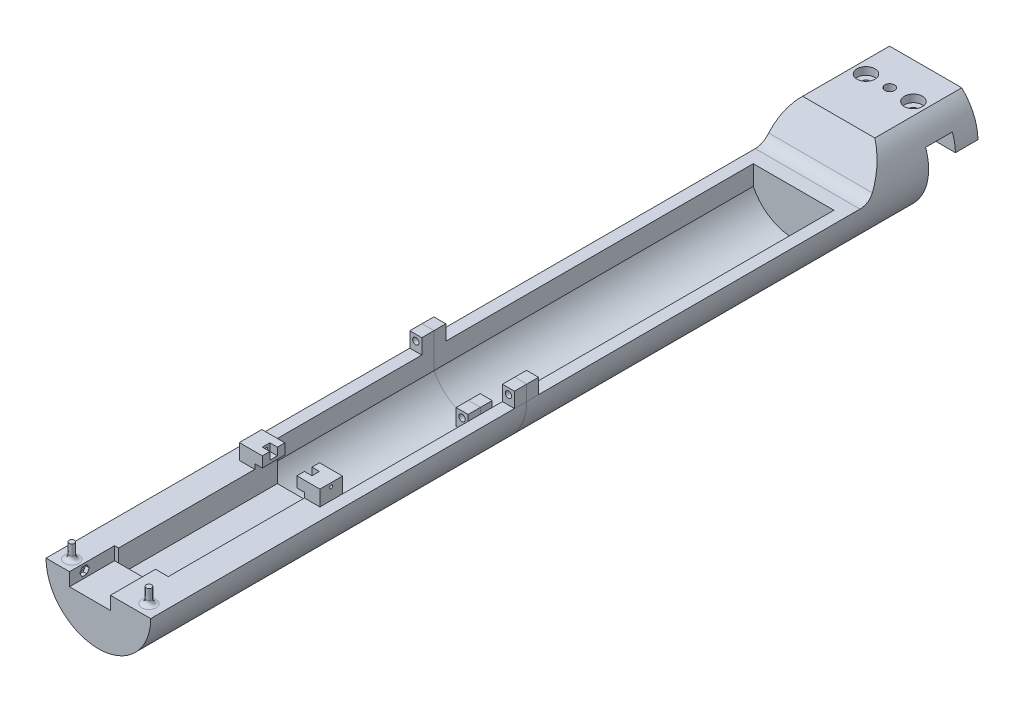
from build123d import *

# Parameters (mm, degrees)
F_1000MM_DEPTH           = 550
F_45MM_46MM_DEPTH        = 17.8
CUT_EXTRUDE_2_REACH      = 554.607
SKETCH_4_R               = 3.25
SKETCH_4_R_2             = 2.3
F_6_5MM_5MM_DEPTH        = 17.8
SKETCH_10_R              = 2.3
DEEP16MM_DEPTH           = 16
SKETCH_16_R              = 6
F_5MM_DEPTH              = 5
SKETCH_17_R              = 6
F_5MM_2_DEPTH            = 5
CUT_EXTRUDE_START        = -477.2
CUT_EXTRUDE_7_DEPTH      = 477.2
F_69_6MM_DEPTH           = 50
FILLET_1_R               = 10
SKETCH_22_W              = 33
SKETCH_22_H              = 15.7
CUT_EXTRUDE_9_DEPTH      = 200
CUT_EXTRUDE_START_2      = 87.8
CUT_EXTRUDE_12_DEPTH     = 326.7
SKETCH5_W                = 10.3
SKETCH5_H                = 10.3
BOSS_EXTRUDE1_DEPTH      = 0.1
SKETCH11_W               = 2.7
SKETCH11_H               = 30
CUT_EXTRUDE5_DEPTH       = 15.7
SKETCH12_W               = 8.5
SKETCH12_H               = 30
BOSS_EXTRUDE2_DEPTH      = 15.7
SKETCH14_W               = 27.2
SKETCH14_H               = 30
BOSS_EXTRUDE3_DEPTH      = 7
SKETCH19_W               = 8
SKETCH19_H               = 16
BOSS_EXTRUDE5_DEPTH      = 10
CUT_EXTRUDE9_REACH       = 314.797
SKETCH20_R               = 2.1
BOSS_EXTRUDE7_REACH      = 554.854
BOSS_EXTRUDE7_END_RADIUS = 29.8
SKETCH22_W               = 8
SKETCH22_H               = 16
CUT_EXTRUDE10_REACH      = 314.797
SKETCH23_R               = 2.1
SKETCH_32_R              = 1.8
BOSS_EXTRUDE9_DEPTH      = 10
FILLET4_R                = 3
CUT_EXTRUDE11_REACH      = 556.148
CUT_EXTRUDE11_END_RADIUS = 34.8
SKETCH13_R               = 1.6
CUT_EXTRUDE12_DEPTH      = 2.5
SKETCH25_R               = 3
CUT_EXTRUDE13_DEPTH      = 10
SKETCH26_W               = 5
SKETCH26_H               = 7
BOSS_EXTRUDE10_DEPTH     = 15
SKETCH27_W               = 5
SKETCH27_H               = 5
CUT_EXTRUDE14_DEPTH      = 5
SKETCH28_R               = 1
CUT_EXTRUDE15_DEPTH      = 555.93966755


# Read off the part's stored shape, not the designer's step: 切除-拉伸12
with BuildPart() as part:
    # 草图1 → 1000mm (new body)
    with BuildSketch(Plane.XY):
        with BuildLine():
            Line((24, 19.214285714), (-24, 19.214285714))
            ThreePointArc((-24, 19.214285714), (0, -40.785714286), (24, 19.214285714))
        make_face()
    extrude(amount=F_1000MM_DEPTH)

    # 草图2 → 45mm到46mm (cut)
    with BuildSketch(Plane(origin=(0, 0, 15), x_dir=(-1, 0, 0), z_dir=(0, 0, -1))):
        with BuildLine():
            Line((-32.77422768, 5.714285714), (32.77422768, 5.714285714))
            ThreePointArc((32.77422768, 5.714285714), (0, -40.785714286), (-32.77422768, 5.714285714))
        make_face()
    extrude(amount=-F_45MM_46MM_DEPTH, mode=Mode.SUBTRACT)

    # 草图3 → 切除-拉伸2 (cut, up to next)
    with BuildSketch(Plane(origin=(0, 0, 0), x_dir=(-1, 0, 0), z_dir=(0, 0, -1)), mode=Mode.PRIVATE) as cut_extrude_2_sk1:
        with BuildLine():
            Line((-34.792959058, -5.285714286), (34.792959058, -5.285714286))
            ThreePointArc((34.792959058, -5.285714286), (0, -40.785714286), (-34.792959058, -5.285714286))
        make_face()
    cut_extrude_2_tool1 = extrude(cut_extrude_2_sk1.sketch, amount=-CUT_EXTRUDE_2_REACH, mode=Mode.PRIVATE) & part.part
    add(cut_extrude_2_tool1.solids().sort_by_distance((0, -20.377758, 0))[0], mode=Mode.SUBTRACT)

    # 草图4 → 6.5mm&5mm (cut)
    with BuildSketch(Plane.XZ.offset(-5.714285714)):
        with Locations(Location((0, 23.9, 0), (0, 0, 270))):
            Circle(SKETCH_4_R)
        with Locations(Location((-15.77422768, 23.9, 0), (0, 0, 270))):
            Circle(SKETCH_4_R_2)
        with Locations(Location((15.77422768, 23.9, 0), (0, 0, 270))):
            Circle(SKETCH_4_R_2)
    extrude(amount=-F_6_5MM_5MM_DEPTH, mode=Mode.SUBTRACT)

    # 草图10 → 圆孔deep16mm (cut)
    with BuildSketch(Plane.XY.offset(32.8)):
        with Locations((-16, -15.785714286)):
            Circle(SKETCH_10_R)
        with Locations(Location((16, -15.785714286, 0), (0, 0, 180))):
            Circle(SKETCH_10_R)
    extrude(amount=DEEP16MM_DEPTH, mode=Mode.SUBTRACT)

    # 草图16 → 5mm (cut)
    with BuildSketch(Plane(origin=(0, 19.214285714, 0), x_dir=(1, 0, 0), z_dir=(0, 1, 0))):
        with Locations(Location((-15.77422768, -23.9, 0), (0, 0, 270))):
            Circle(SKETCH_16_R)
        with Locations(Location((15.77422768, -23.9, 0), (0, 0, 270))):
            Circle(SKETCH_16_R)
    extrude(amount=-F_5MM_DEPTH, mode=Mode.SUBTRACT)

    # 草图17 → 5mm 2 (cut)
    with BuildSketch(Plane(origin=(0, 0, 32.8), x_dir=(-1, 0, 0), z_dir=(0, 0, -1))):
        with Locations((-16, -15.785714286)):
            Circle(SKETCH_17_R)
        with Locations((16, -15.785714286)):
            Circle(SKETCH_17_R)
    extrude(amount=-F_5MM_2_DEPTH, mode=Mode.SUBTRACT)

    # 草图19 → 切除-拉伸7 (cut)
    with BuildSketch(Plane.XY.offset(550).offset(CUT_EXTRUDE_START)):
        with BuildLine():
            Line((-34.8, -5.985714286), (34.8, -5.985714286))
            ThreePointArc((34.8, -5.985714286), (0, 28.814285714), (-34.8, -5.985714286))
        make_face()
    extrude(amount=CUT_EXTRUDE_7_DEPTH, mode=Mode.SUBTRACT)

    # 草图20 → 宽69.6mm (cut, symmetric)
    with BuildSketch(Plane(origin=(0, 0, 0), x_dir=(0, 0, -1), z_dir=(1, 0, 0))):
        Polygon((-72.8, -5.985714286), (-57.8, 19.214285714), (-72.8, 19.214285714), align=None)
    extrude(amount=F_69_6MM_DEPTH, both=True, mode=Mode.SUBTRACT)

    # 圆角1
    fillet_1_edges = [part.edges().sort_by_distance(p)[0] for p in [
        (0, -5.985714286, 72.8),
    ]]
    fillet(fillet_1_edges, radius=FILLET_1_R)

    # 草图22 → 切除-拉伸9 (cut)
    with BuildSketch(Plane.XY.offset(550)):
        with Locations((0, -13.835714286)):
            Rectangle(SKETCH_22_W, SKETCH_22_H)
    extrude(amount=-CUT_EXTRUDE_9_DEPTH, mode=Mode.SUBTRACT)

    # 切除-拉伸12 outline → 切除-拉伸12 (cut)
    with BuildSketch(Plane.XY.offset(CUT_EXTRUDE_START_2)):
        with BuildLine():
            Line((-26.8, -5.985714286), (-26.8, -19.016447189))
            ThreePointArc((-26.8, -19.016447189), (0, -35.785714286), (26.8, -19.016447189))
            Line((26.8, -19.016447189), (26.8, -5.985714286))
            Line((26.8, -5.985714286), (-26.8, -5.985714286))
        make_face()
    extrude(amount=CUT_EXTRUDE_12_DEPTH, mode=Mode.SUBTRACT)

    # Sketch5 → Boss-Extrude1 (add)
    with BuildSketch(Plane(origin=(0, 0, 414.5), x_dir=(-1, 0, 0), z_dir=(0, 0, -1))):
        with Locations((21.65, -0.835714286)):
            Rectangle(SKETCH5_W, SKETCH5_H)
    extrude(amount=-BOSS_EXTRUDE1_DEPTH)


with BuildPart() as body_2:
    # Split1: the piece on the far side of the plane
    add(part.part)
    split(bisect_by=Plane(origin=(0, 0, 300), x_dir=(-1, 0, 0), z_dir=(0, 0, -1)), keep=Keep.BOTTOM)

    # Sketch11 → Cut-Extrude5 (cut)
    with BuildSketch(Plane(origin=(0, -5.985714286, 0), x_dir=(1, 0, 0), z_dir=(0, 1, 0))):
        with Locations((-17.85, -535)):
            Rectangle(SKETCH11_W, SKETCH11_H)
    extrude(amount=-CUT_EXTRUDE5_DEPTH, mode=Mode.SUBTRACT)

    # Sketch12 → Boss-Extrude2 (add)
    with BuildSketch(Plane(origin=(0, -5.985714286, 0), x_dir=(1, 0, 0), z_dir=(0, 1, 0))):
        with Locations((12.25, -535)):
            Rectangle(SKETCH12_W, SKETCH12_H)
    extrude(amount=-BOSS_EXTRUDE2_DEPTH)

    # Sketch14 → Boss-Extrude3 (add)
    with BuildSketch(Plane(origin=(0, -21.685714286, 0), x_dir=(1, 0, 0), z_dir=(0, 1, 0))):
        with Locations((-5.6, -535)):
            Rectangle(SKETCH14_W, SKETCH14_H)
    extrude(amount=BOSS_EXTRUDE3_DEPTH)


with BuildPart() as part_1:
    add(part.part)

    # Split1
    split(bisect_by=Plane(origin=(0, 0, 300), x_dir=(-1, 0, 0), z_dir=(0, 0, -1)), keep=Keep.TOP)

    add(body_2.part)  # Boss-Extrude5 merges body 2
    # Sketch19 → Boss-Extrude5 (add)
    with BuildSketch(Plane(origin=(0, -5.985714286, 0), x_dir=(1, 0, 0), z_dir=(0, 1, 0))):
        with Locations((-30.8, -300.168081581)):
            Rectangle(SKETCH19_W, SKETCH19_H)
        with Locations((30.8, -300.168081581)):
            Rectangle(SKETCH19_W, SKETCH19_H)
    extrude(amount=BOSS_EXTRUDE5_DEPTH)

    # Sketch20 → Cut-Extrude9 (cut, up to next)
    with BuildSketch(Plane.XY.offset(308.168081581), mode=Mode.PRIVATE) as cut_extrude9_sk1:
        with Locations((-30.8, 0.014285714)):
            Circle(SKETCH20_R)
    cut_extrude9_tool1 = extrude(cut_extrude9_sk1.sketch, amount=-CUT_EXTRUDE9_REACH, mode=Mode.PRIVATE) & part_1.part
    # Sketch20 → Cut-Extrude9 (cut, up to next)
    with BuildSketch(Plane.XY.offset(308.168081581), mode=Mode.PRIVATE) as cut_extrude9_sk2:
        with Locations((30.8, 0.014285714)):
            Circle(SKETCH20_R)
    cut_extrude9_tool2 = extrude(cut_extrude9_sk2.sketch, amount=-CUT_EXTRUDE9_REACH, mode=Mode.PRIVATE) & part_1.part
    add(cut_extrude9_tool1.solids().sort_by_distance((-30.8, 0.014286, 308.168082))[0], mode=Mode.SUBTRACT)
    add(cut_extrude9_tool2.solids().sort_by_distance((30.8, 0.014286, 308.168082))[0], mode=Mode.SUBTRACT)

    # Boss-Extrude7: up to this cylinder (the profile starts inside it)
    boss_extrude7_end = Plane(origin=(0, -5.985714286, 300.168082), z_dir=(0, 0, -1)) * Cylinder(BOSS_EXTRUDE7_END_RADIUS, 1170.308, mode=Mode.PRIVATE)
    # Sketch22 → Boss-Extrude7 (add, up to the surface)
    with BuildSketch(Plane(origin=(0, -24.785714286, 0), x_dir=(-1, 0, 0), z_dir=(0, -1, 0)), mode=Mode.PRIVATE) as boss_extrude7_sk1:
        with Locations((0, -300.168081581)):
            Rectangle(SKETCH22_W, SKETCH22_H)
    boss_extrude7_tool1 = extrude(boss_extrude7_sk1.sketch, amount=BOSS_EXTRUDE7_REACH, mode=Mode.PRIVATE) & boss_extrude7_end
    add(boss_extrude7_tool1.solids().sort_by_distance((0, -24.785714, 300.168082))[0])

    # Sketch23 → Cut-Extrude10 (cut, up to next)
    with BuildSketch(Plane.XY.offset(308.168081581), mode=Mode.PRIVATE) as cut_extrude10_sk1:
        with Locations((0, -28.785714286)):
            Circle(SKETCH23_R)
    cut_extrude10_tool1 = extrude(cut_extrude10_sk1.sketch, amount=-CUT_EXTRUDE10_REACH, mode=Mode.PRIVATE) & part_1.part
    add(cut_extrude10_tool1.solids().sort_by_distance((0, -28.785714, 308.168082))[0], mode=Mode.SUBTRACT)


with BuildPart() as body_2_2:
    # Split6: the piece on the far side of the plane
    add(part_1.part)
    split(bisect_by=Plane(origin=(0, 0, 300), x_dir=(-1, 0, 0), z_dir=(0, 0, -1)), keep=Keep.BOTTOM)

    # 草图32 → Boss-Extrude9 (add)
    with BuildSketch(Plane(origin=(0, -5.985714286, 0), x_dir=(1, 0, 0), z_dir=(0, 1, 0))):
        with Locations(Location((25.65, -542, 0), (0, 0, 90))):
            Circle(SKETCH_32_R)
        with Locations(Location((-25.65, -542, 0), (0, 0, 90))):
            Circle(SKETCH_32_R)
    extrude(amount=BOSS_EXTRUDE9_DEPTH)

    # Fillet4
    fillet4_edges = [body_2_2.edges().sort_by_distance(p)[0] for p in [
        (25.65, -5.985714286, 543.8),
        (-25.65, -5.985714286, 543.8),
    ]]
    fillet(fillet4_edges, radius=FILLET4_R)

    # Cut-Extrude11: up to this cylinder (the profile starts inside it)
    cut_extrude11_end = Plane(origin=(0, -5.985714286, 540), z_dir=(0, 0, -1)) * Cylinder(CUT_EXTRUDE11_END_RADIUS, 1182.896, mode=Mode.PRIVATE)
    # Sketch13 → Cut-Extrude11 (cut, up to the surface)
    with BuildSketch(Plane(origin=(-19.2, 0, 0), x_dir=(0, 0, -1), z_dir=(1, 0, 0)), mode=Mode.PRIVATE) as cut_extrude11_sk1:
        with Locations((-540, -10.4)):
            Circle(SKETCH13_R)
    cut_extrude11_tool1 = extrude(cut_extrude11_sk1.sketch, amount=-CUT_EXTRUDE11_REACH, mode=Mode.PRIVATE) & cut_extrude11_end
    add(cut_extrude11_tool1.solids().sort_by_distance((-19.2, -10.4, 540))[0], mode=Mode.SUBTRACT)

    # Sketch24 → Cut-Extrude12 (cut)
    with BuildSketch(Plane(origin=(-19.2, 0, 0), x_dir=(0, 0, -1), z_dir=(1, 0, 0))):
        Polygon((-538.359667753, -13.118941605), (-536.825161375, -10.338901406), (-538.465493622, -7.619959801), (-541.640332247, -7.681058395), (-543.174838625, -10.461098594), (-541.534506378, -13.180040199), align=None)
    extrude(amount=-CUT_EXTRUDE12_DEPTH, mode=Mode.SUBTRACT)

    # Sketch25 → Cut-Extrude13 (cut)
    with BuildSketch(Plane.ZY.offset(34.8)):
        with Locations((540, -10.4)):
            Circle(SKETCH25_R)
    extrude(amount=-CUT_EXTRUDE13_DEPTH, mode=Mode.SUBTRACT)

    # Sketch26 → Boss-Extrude10 (add)
    with BuildSketch(Plane(origin=(0, 0, 414.5), x_dir=(-1, 0, 0), z_dir=(0, 0, -1))):
        Polygon((16.5, -5.985714286), (26.8, -5.985714286), (26.8, 4.314285714), (16.5, 4.314285714), (16.5, -2.685714286), align=None)
        with Locations((14, 0.814285714)):
            Rectangle(SKETCH26_W, SKETCH26_H)
        with Locations((-14, 0.814285714)):
            Rectangle(SKETCH26_W, SKETCH26_H)
        Polygon((-16.5, -2.685714286), (-16.5, 4.314285714), (-26.8, 4.314285714), (-26.8, -5.985714286), (-16.5, -5.985714286), align=None)
    extrude(amount=-BOSS_EXTRUDE10_DEPTH)

    # Sketch27 → Cut-Extrude14 (cut)
    with BuildSketch(Plane(origin=(0, 4.314285714, 0), x_dir=(1, 0, 0), z_dir=(0, 1, 0))):
        Polygon((-11.5, -424.5), (-11.5, -422), (-11.5, -419.5), (-16.5, -419.5), (-16.5, -424.5), align=None)
        with Locations((14, -422)):
            Rectangle(SKETCH27_W, SKETCH27_H)
    extrude(amount=-CUT_EXTRUDE14_DEPTH, mode=Mode.SUBTRACT)

    # Sketch28 → Cut-Extrude15 (cut, through all)
    with BuildSketch(Plane.ZY.offset(26.8)):
        with Locations((422, 1.814285714)):
            Circle(SKETCH28_R)
    extrude(amount=-CUT_EXTRUDE15_DEPTH, mode=Mode.SUBTRACT)


with BuildPart() as part_2:
    add(part_1.part)

    # Split6
    split(bisect_by=Plane(origin=(0, 0, 300), x_dir=(-1, 0, 0), z_dir=(0, 0, -1)), keep=Keep.TOP)


solid = Compound([body_2_2.part, part_2.part])
